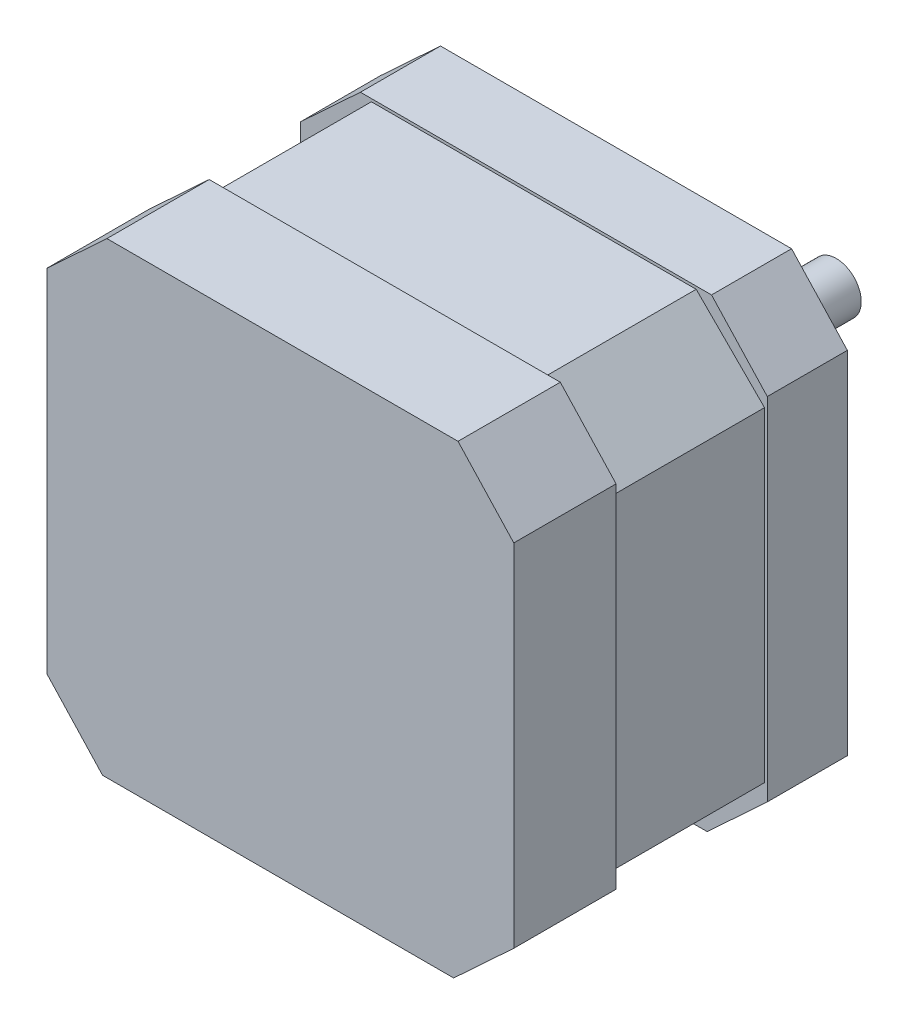
from build123d import *

# Parameters (mm, degrees)
RESSALTO_EXTRUS_O1_DEPTH   = 30
CORTE_EXTRUS_O_FINA1_START = -22.8
CORTE_EXTRUS_O_FINA1_DEPTH = 13.6
ESBO_O3_R                  = 2.25
RESSALTO_EXTRUS_O2_DEPTH   = 20
ESBO_O4_R                  = 10
RESSALTO_EXTRUS_O3_DEPTH   = 2
ESBO_O5_R                  = 1.5
CORTE_EXTRUS_O1_DEPTH      = 10


# Read off the part's stored shape, not the designer's step: Corte-Extrusão-Fina1
with BuildPart() as part:
    # Esboço1 → Ressalto-extrusão1 (new body)
    with BuildSketch(Plane.XY):
        Polygon((-21, -15.592171873), (-15.984175996, -21), (15.592171873, -21), (21, -15.984175996), (21, 15.592171873), (15.984175996, 21), (-15.592171873, 21), (-21, 15.984175996), align=None)
    extrude(amount=RESSALTO_EXTRUS_O1_DEPTH)

    # Corte-Extrusão-Fina1 outline → Corte-Extrusão-Fina1 (cut)
    with BuildSketch(Plane.XY.offset(30).offset(CORTE_EXTRUS_O_FINA1_START)):
        Polygon((15.592171873, -21), (21, -15.984175996), (21, 15.592171873), (15.984175996, 21), (-15.592171873, 21), (-21, 15.984175996), (-21, -15.592171873), (-15.984175996, -21), align=None)
        Polygon((14.605339059, 20.75), (20.75, 14.605339059), (20.75, -14.605339059), (14.605339059, -20.75), (-14.605339059, -20.75), (-20.75, -14.605339059), (-20.75, 14.605339059), (-14.605339059, 20.75), align=None, mode=Mode.SUBTRACT)
    extrude(amount=CORTE_EXTRUS_O_FINA1_DEPTH, mode=Mode.SUBTRACT)

    # Esboço3 → Ressalto-extrusão2 (add)
    with BuildSketch(Plane(origin=(0, 0, 0), x_dir=(-1, 0, 0), z_dir=(0, 0, -1))):
        with Locations(Location((0, 0, 0), (0, 0, 180))):
            Circle(ESBO_O3_R)
    extrude(amount=RESSALTO_EXTRUS_O2_DEPTH)

    # Esboço4 → Ressalto-extrusão3 (add)
    with BuildSketch(Plane(origin=(0, 0, 0), x_dir=(-1, 0, 0), z_dir=(0, 0, -1))):
        with Locations(Location((0, 0, 0), (0, 0, 180))):
            Circle(ESBO_O4_R)
    extrude(amount=RESSALTO_EXTRUS_O3_DEPTH)

    # Esboço5 → Corte-extrusão1 (cut)
    with BuildSketch(Plane(origin=(0, 0, 0), x_dir=(-1, 0, 0), z_dir=(0, 0, -1))):
        with Locations((15.5, -15.5)):
            Circle(ESBO_O5_R)
        with Locations((-15.5, -15.5)):
            Circle(ESBO_O5_R)
        with Locations((-15.5, 15.5)):
            Circle(ESBO_O5_R)
        with Locations((15.5, 15.5)):
            Circle(ESBO_O5_R)
    extrude(amount=-CORTE_EXTRUS_O1_DEPTH, mode=Mode.SUBTRACT)


solid = part.part
